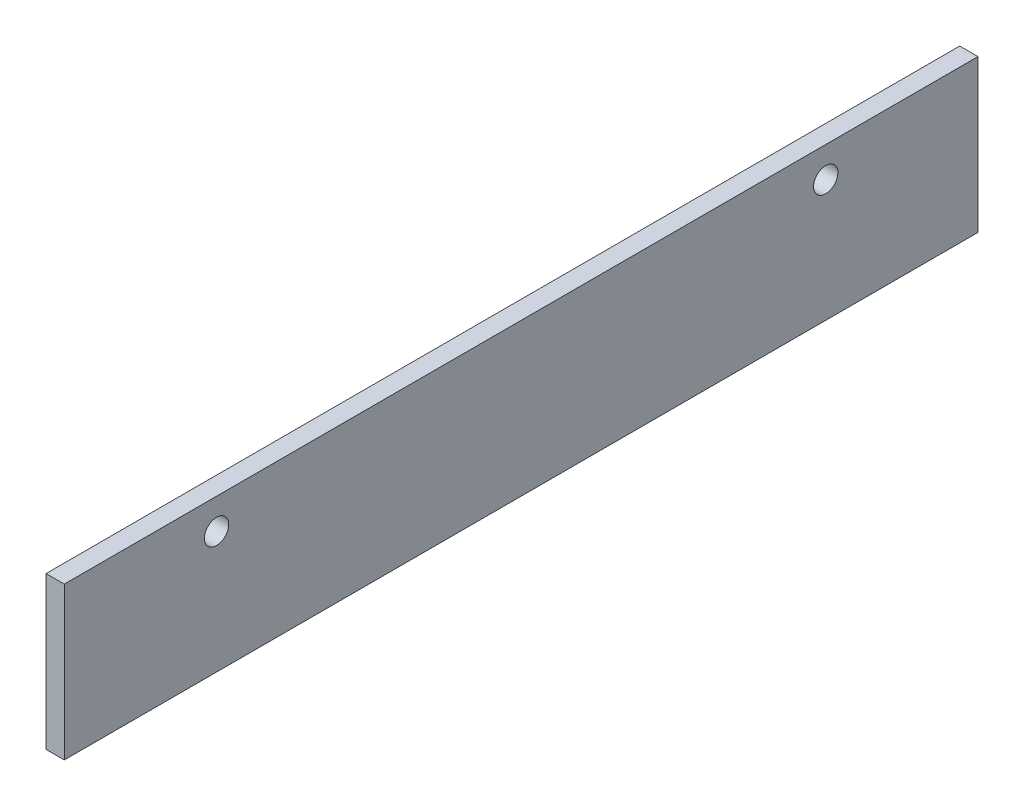
from build123d import *

# Parameters (mm, degrees)
SKETCH1_W          = 300
SKETCH1_H          = 50
EXTRUDE1_DEPTH     = 6
SKETCH2_R          = 4
CUT_EXTRUDE1_DEPTH = 6


with BuildPart() as part:
    # Sketch1 → Extrude1 (new body)
    with BuildSketch(Plane(origin=(0, 0, 0), x_dir=(0, 0, -1), z_dir=(1, 0, 0))):
        Rectangle(SKETCH1_W, SKETCH1_H)
    extrude(amount=EXTRUDE1_DEPTH)

    # Sketch2 → Cut-Extrude1 (cut)
    with BuildSketch(Plane(origin=(6, 0, 0), x_dir=(0, 0, -1), z_dir=(1, 0, 0))):
        with Locations((-100, 15)):
            Circle(SKETCH2_R)
        with Locations((100, 15)):
            Circle(SKETCH2_R)
    extrude(amount=-CUT_EXTRUDE1_DEPTH, mode=Mode.SUBTRACT)


solid = part.part
